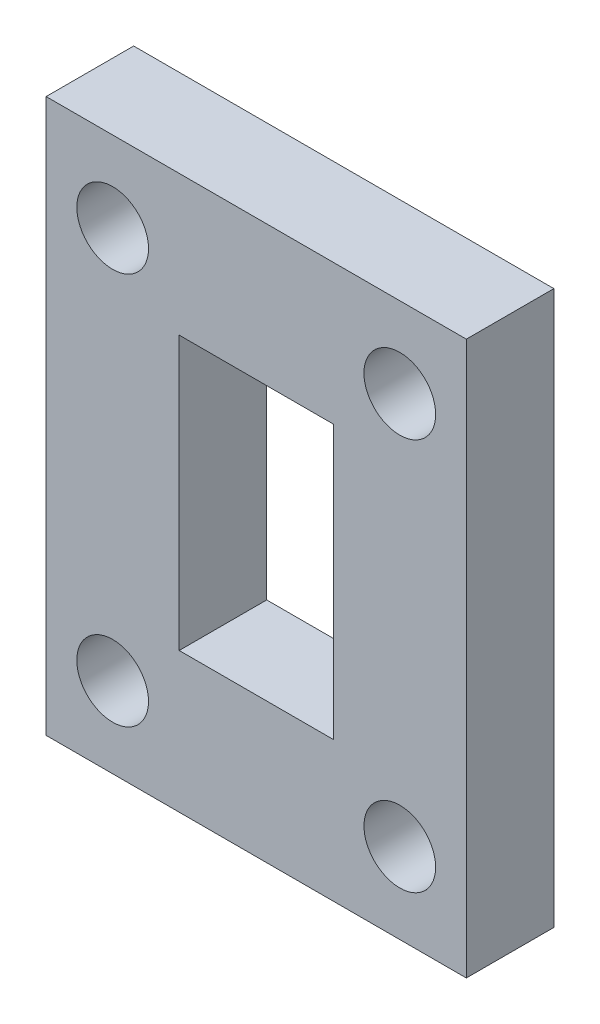
from build123d import *

# Parameters (mm, degrees)
SKETCH1_W           = 15.24
SKETCH1_H           = 20.066
SKETCH1_W_2         = 5.588
SKETCH1_H_2         = 9.906
BOSS_EXTRUDE1_DEPTH = 3.175
CUT_EXTRUDE1_REACH  = 14.993
SKETCH2_R           = 1.3


with BuildPart() as part:
    # Sketch1 → Boss-Extrude1 (new body)
    with BuildSketch(Plane.XY):
        Rectangle(SKETCH1_W, SKETCH1_H)
        Rectangle(SKETCH1_W_2, SKETCH1_H_2, mode=Mode.SUBTRACT)
    extrude(amount=BOSS_EXTRUDE1_DEPTH)

    # Sketch2 → Cut-Extrude1 (cut, up to next)
    with BuildSketch(Plane.XY.offset(3.175), mode=Mode.PRIVATE) as cut_extrude1_sk1:
        with Locations((-5.207, 7.112)):
            Circle(SKETCH2_R)
    cut_extrude1_tool1 = extrude(cut_extrude1_sk1.sketch, amount=-CUT_EXTRUDE1_REACH, mode=Mode.PRIVATE) & part.part
    # Sketch2 → Cut-Extrude1 (cut, up to next)
    with BuildSketch(Plane.XY.offset(3.175), mode=Mode.PRIVATE) as cut_extrude1_sk2:
        with Locations((5.207, 7.112)):
            Circle(SKETCH2_R)
    cut_extrude1_tool2 = extrude(cut_extrude1_sk2.sketch, amount=-CUT_EXTRUDE1_REACH, mode=Mode.PRIVATE) & part.part
    # Sketch2 → Cut-Extrude1 (cut, up to next)
    with BuildSketch(Plane.XY.offset(3.175), mode=Mode.PRIVATE) as cut_extrude1_sk3:
        with Locations((5.207, -7.112)):
            Circle(SKETCH2_R)
    cut_extrude1_tool3 = extrude(cut_extrude1_sk3.sketch, amount=-CUT_EXTRUDE1_REACH, mode=Mode.PRIVATE) & part.part
    # Sketch2 → Cut-Extrude1 (cut, up to next)
    with BuildSketch(Plane.XY.offset(3.175), mode=Mode.PRIVATE) as cut_extrude1_sk4:
        with Locations((-5.207, -7.112)):
            Circle(SKETCH2_R)
    cut_extrude1_tool4 = extrude(cut_extrude1_sk4.sketch, amount=-CUT_EXTRUDE1_REACH, mode=Mode.PRIVATE) & part.part
    add(cut_extrude1_tool1.solids().sort_by_distance((-5.207, 7.112, 3.175))[0], mode=Mode.SUBTRACT)
    add(cut_extrude1_tool2.solids().sort_by_distance((5.207, 7.112, 3.175))[0], mode=Mode.SUBTRACT)
    add(cut_extrude1_tool3.solids().sort_by_distance((5.207, -7.112, 3.175))[0], mode=Mode.SUBTRACT)
    add(cut_extrude1_tool4.solids().sort_by_distance((-5.207, -7.112, 3.175))[0], mode=Mode.SUBTRACT)


solid = part.part
